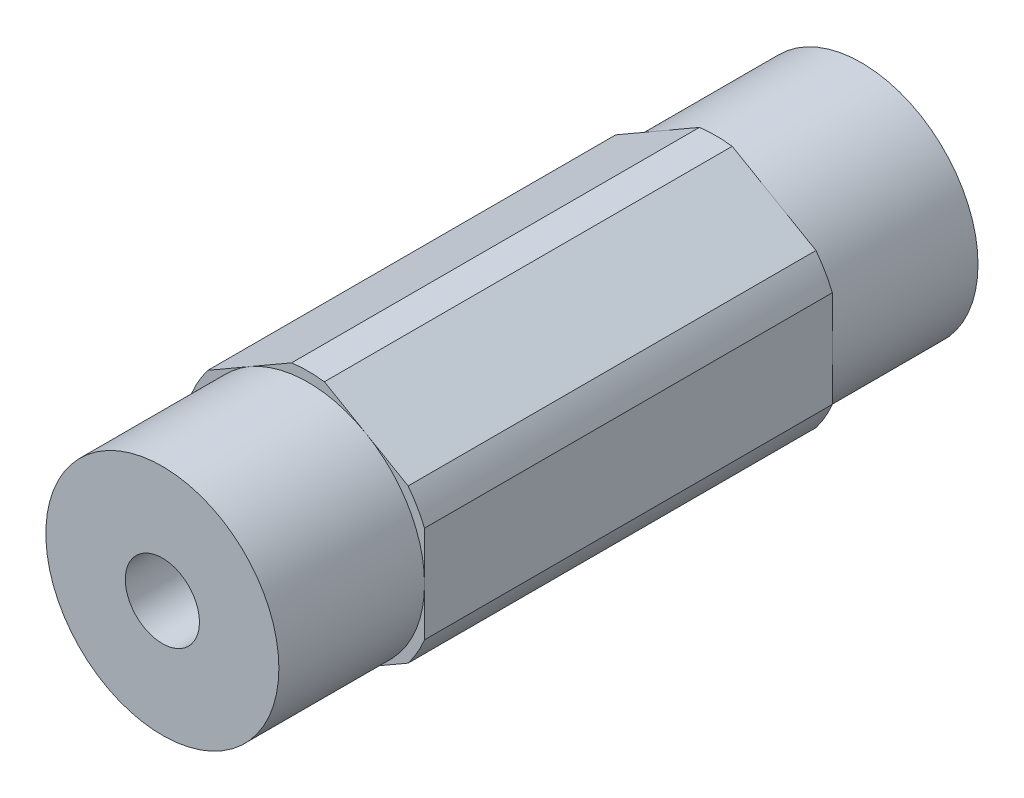
from build123d import *

# Parameters (mm, degrees)
SKETCH1_R                            = 2.0193
BOSS_EXTRUDE1_DEPTH                  = 19.05
F_10_32_TAPPED_HOLE1_D               = 4.0386
F_10_32_TAPPED_HOLE1_DEPTH           = 12.02944
F_10_32_TAPPED_HOLE1_TIP             = 1.213317848
F_10_32_TAPPED_HOLE1_ON_FACE_2_D     = 4.0386
F_10_32_TAPPED_HOLE1_ON_FACE_2_DEPTH = 12.02944
F_10_32_TAPPED_HOLE1_ON_FACE_2_TIP   = 1.213317848
SKETCH5_R                            = 6.874999966
SKETCH5_R_2                          = 6.35
CUT_EXTRUDE1_DEPTH                   = 7.9375


with BuildPart() as part:
    # Sketch1 → Boss-Extrude1 (new, symmetric)
    with BuildSketch(Plane.XY):
        with BuildLine():
            ThreePointArc((0.893039571, 6.816751782), (0, 6.874999966), (-0.893039571, 6.816751782))
            Line((-0.893039571, 6.816751782), (-5.456960429, 4.181770846))
            ThreePointArc((-5.456960429, 4.181770846), (-5.953924622, 3.437499983), (-6.35, 2.634980936))
            Line((-6.35, 2.634980936), (-6.35, -2.634980936))
            ThreePointArc((-6.35, -2.634980936), (-5.953924622, -3.437499983), (-5.456960429, -4.181770846))
            Line((-5.456960429, -4.181770846), (-0.893039571, -6.816751782))
            ThreePointArc((-0.893039571, -6.816751782), (0, -6.874999966), (0.893039571, -6.816751782))
            Line((0.893039571, -6.816751782), (5.456960429, -4.181770846))
            ThreePointArc((5.456960429, -4.181770846), (5.953924622, -3.437499983), (6.35, -2.634980936))
            Line((6.35, -2.634980936), (6.35, 2.634980936))
            ThreePointArc((6.35, 2.634980936), (5.953924622, 3.437499983), (5.456960429, 4.181770846))
            Line((5.456960429, 4.181770846), (0.893039571, 6.816751782))
        make_face()
        Circle(SKETCH1_R, mode=Mode.SUBTRACT)
    extrude(amount=BOSS_EXTRUDE1_DEPTH, both=True)

    # #10-32 Tapped Hole1
    with Locations(Plane.XY.offset(19.05)):
        with Locations((0, 0)):
            Hole(F_10_32_TAPPED_HOLE1_D / 2, depth=F_10_32_TAPPED_HOLE1_DEPTH)
            with Locations((0, 0, -(F_10_32_TAPPED_HOLE1_DEPTH + F_10_32_TAPPED_HOLE1_TIP / 2))):  # 118° drill point
                Cone(0, F_10_32_TAPPED_HOLE1_D / 2, F_10_32_TAPPED_HOLE1_TIP, mode=Mode.SUBTRACT)

    # #10-32 Tapped Hole1 on face 2
    with Locations(Plane.XY.offset(-19.05)):
        with Locations((0, 0)):
            Hole(F_10_32_TAPPED_HOLE1_ON_FACE_2_D / 2, depth=F_10_32_TAPPED_HOLE1_ON_FACE_2_DEPTH)
            with Locations((0, 0, -(F_10_32_TAPPED_HOLE1_ON_FACE_2_DEPTH + F_10_32_TAPPED_HOLE1_ON_FACE_2_TIP / 2))):  # 118° drill point
                Cone(0, F_10_32_TAPPED_HOLE1_ON_FACE_2_D / 2, F_10_32_TAPPED_HOLE1_ON_FACE_2_TIP, mode=Mode.SUBTRACT)

    # Sketch5 → Cut-Extrude1 (cut)
    with BuildSketch(Plane.XY.offset(19.05)):
        Circle(SKETCH5_R)
        Circle(SKETCH5_R_2, mode=Mode.SUBTRACT)
    cut_extrude1 = extrude(amount=-CUT_EXTRUDE1_DEPTH, mode=Mode.SUBTRACT)

    # Mirror1: Cut-Extrude1 across plane
    add(cut_extrude1.mirror(Plane.XY), mode=Mode.SUBTRACT)


solid = part.part
